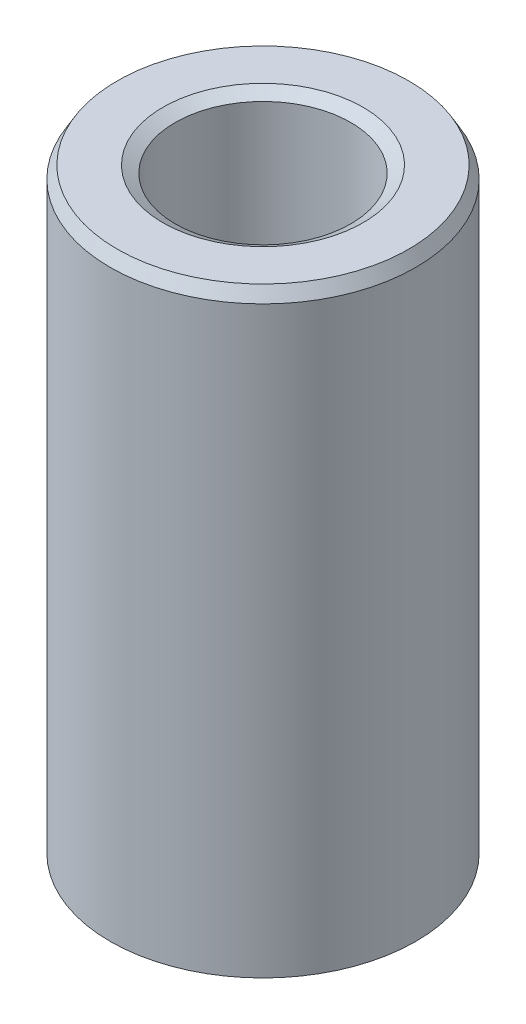
from build123d import *
from OCP.BRepFilletAPI import BRepFilletAPI_MakeChamfer

# Parameters (mm, degrees)
SKETCH1_R           = 35
BOSS_EXTRUDE1_DEPTH = 138.092901056
SKETCH2_R           = 20.114046317
CUT_EXTRUDE1_DEPTH  = 147.695771317
CHAMFER1_SIZE       = 2.805327172
CHAMFER1_SIZE2      = 1.619656398


with BuildPart() as part:
    # Sketch1 → Boss-Extrude1 (new body)
    with BuildSketch(Plane(origin=(0, 0, 0), x_dir=(1, 0, 0), z_dir=(0, 1, 0))):
        Circle(SKETCH1_R)
    extrude(amount=BOSS_EXTRUDE1_DEPTH)

    # Sketch2 → Cut-Extrude1 (cut, through all)
    with BuildSketch(Plane(origin=(0, 0, 0), x_dir=(1, 0, 0), z_dir=(0, 1, 0))):
        Circle(SKETCH2_R)
    extrude(amount=CUT_EXTRUDE1_DEPTH, mode=Mode.SUBTRACT)

    # Chamfer1: one chamfer whose edges measure the first distance from different faces: ONE call of the kernel's chamfer builder (chamfer() names one face for all edges)
    chamfer1_edges_1 = [part.edges().sort_by_distance(p)[0] for p in [
        (-20.114046317, 138.092901056, 0),
    ]]
    chamfer1_side_1 = [part.faces().sort_by_distance(p)[0] for p in [
        (-34.010050506, 138.092901056, 0),
    ]]
    chamfer1_edges_2 = [part.edges().sort_by_distance(p)[0] for p in [
        (-20.114046317, 0, 0),
    ]]
    chamfer1_side_2 = [part.faces().sort_by_distance(p)[0] for p in [
        (-20.114046317, 69.046450528, 0),
    ]]
    chamfer1_edges_3 = [part.edges().sort_by_distance(p)[0] for p in [
        (-35, 0, 0),
    ]]
    chamfer1_side_3 = [part.faces().sort_by_distance(p)[0] for p in [
        (-34.010050506, 0, 0),
    ]]
    chamfer1_edges_4 = [part.edges().sort_by_distance(p)[0] for p in [
        (-35, 138.092901056, 0),
    ]]
    chamfer1_side_4 = [part.faces().sort_by_distance(p)[0] for p in [
        (-35, 69.046450528, 0),
    ]]
    chamfer1 = BRepFilletAPI_MakeChamfer(part.part.solid().wrapped)
    for e in chamfer1_edges_1:
        chamfer1.Add(CHAMFER1_SIZE, CHAMFER1_SIZE2, e.wrapped, chamfer1_side_1[0].wrapped)  # the first distance lies on this face
    for e in chamfer1_edges_2:
        chamfer1.Add(CHAMFER1_SIZE, CHAMFER1_SIZE2, e.wrapped, chamfer1_side_2[0].wrapped)  # the first distance lies on this face
    for e in chamfer1_edges_3:
        chamfer1.Add(CHAMFER1_SIZE, CHAMFER1_SIZE2, e.wrapped, chamfer1_side_3[0].wrapped)  # the first distance lies on this face
    for e in chamfer1_edges_4:
        chamfer1.Add(CHAMFER1_SIZE, CHAMFER1_SIZE2, e.wrapped, chamfer1_side_4[0].wrapped)  # the first distance lies on this face
    add(Compound.cast(chamfer1.Shape()), mode=Mode.REPLACE)


solid = part.part
